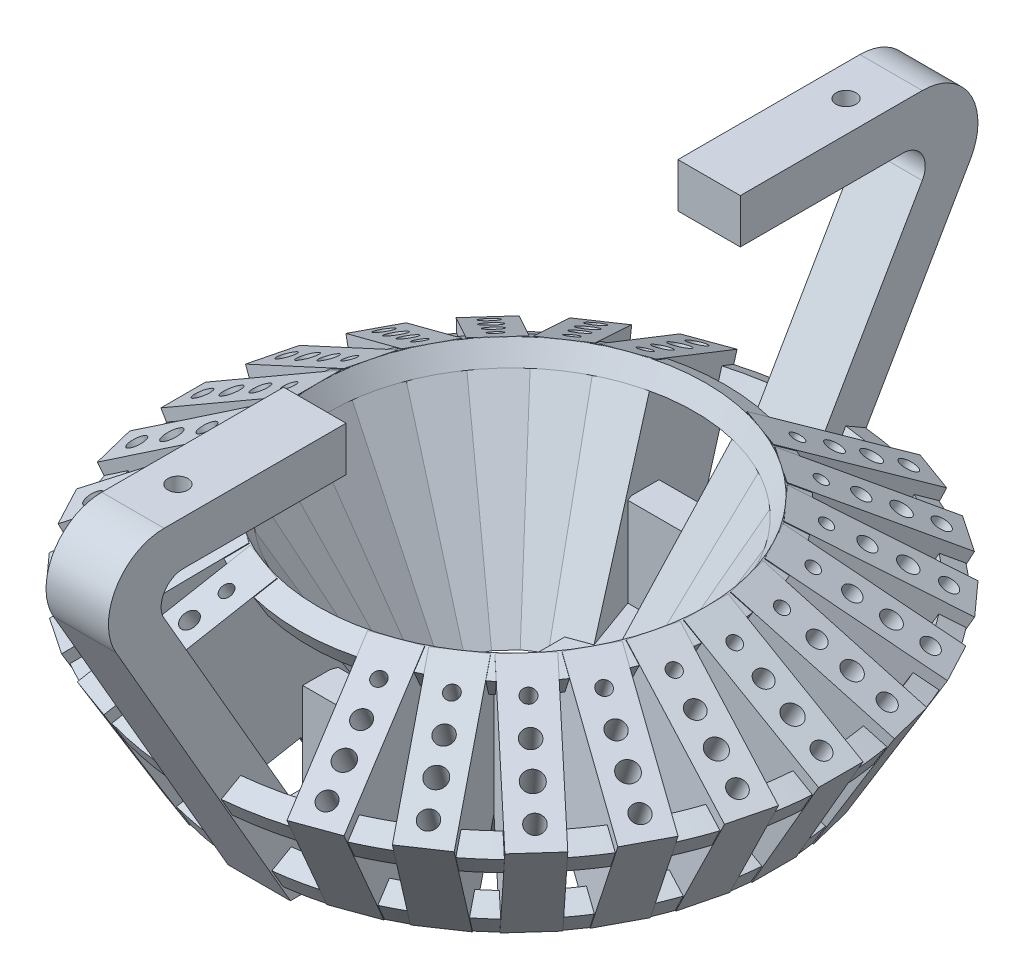
from build123d import *

# Parameters (mm, degrees)
KEYPIECE_DEPTH      = 1
REVOLVE4_ANGLE      = 90
REVOLVE5_ANGLE      = 90
CIRPATTERN12_COUNT  = 6
CIRPATTERN12_ANGLE  = 70
CIRPATTERN14_COUNT  = 6
CIRPATTERN14_ANGLE  = 70
SKKEYPIECEHOLES_8_R = 0.39
CUT_EXTRUDE8_DEPTH  = 5
SKKEYPIECEHOLES_R   = 0.3
SKKEYPIECEHOLES_R_2 = 0.43
CUT_EXTRUDE5_DEPTH  = 20.870506705
CIRPATTERN15_COUNT  = 6
CIRPATTERN15_ANGLE  = 70
CIRPATTERN16_COUNT  = 6
CIRPATTERN16_ANGLE  = 70
BOSS_EXTRUDE2_DEPTH = 1.4
SKETCH15_R          = 0.8
CUT_EXTRUDE6_DEPTH  = 10
SKETCH16_W          = 2.8
SKETCH16_H          = 1.5
BOSS_EXTRUDE4_DEPTH = 4
SKETCH17_R          = 0.45
CUT_EXTRUDE7_DEPTH  = 3.5


with BuildPart() as part:
    # skKeyPiece → KeyPiece (new, symmetric)
    with BuildSketch(Plane.XY):
        Polygon((8.700961894, 18.070508076), (14.763139721, 14.570508076), (11.763139721, 9.374355653), (7.866025404, 11.624355653), (5.866025404, 8.160254038), (5, 8.660254038), (3.700961894, 9.410254038), align=None)
    keypiece = extrude(amount=KEYPIECE_DEPTH, both=True)

    # Sketch11 → Revolve4 (revolve)
    with BuildSketch(Plane.XY):
        Polygon((14.523318583, 14.15512568), (13.657293179, 14.65512568), (13.157293179, 13.789100276), (14.023318583, 13.289100276), align=None)
        Polygon((6.366025404, 9.026279442), (5.5, 9.526279442), (5, 8.660254038), (5.866025404, 8.160254038), align=None)
        Polygon((11.763139721, 9.374355653), (12.263139721, 10.240381057), (11.397114317, 10.740381057), (10.897114317, 9.874355653), align=None)
        Polygon((8.700961894, 18.070508076), (8.200961894, 17.204482672), (9.066987298, 16.704482672), (9.566987298, 17.570508076), align=None)
    revolve(axis=Axis((0, 29.225564846, 0), (0, -1, 0)), revolution_arc=REVOLVE4_ANGLE)

    # Sketch11<2> → Revolve5 (revolve)
    with BuildSketch(Plane.XY):
        Polygon((14.523318583, 14.15512568), (13.657293179, 14.65512568), (13.157293179, 13.789100276), (14.023318583, 13.289100276), align=None)
        Polygon((6.366025404, 9.026279442), (5.5, 9.526279442), (5, 8.660254038), (5.866025404, 8.160254038), align=None)
        Polygon((11.763139721, 9.374355653), (12.263139721, 10.240381057), (11.397114317, 10.740381057), (10.897114317, 9.874355653), align=None)
        Polygon((8.700961894, 18.070508076), (8.200961894, 17.204482672), (9.066987298, 16.704482672), (9.566987298, 17.570508076), align=None)
    revolve(axis=Axis((0, 29.225564846, 0), (0, 1, 0)), revolution_arc=REVOLVE5_ANGLE)

    # CirPattern12: KeyPiece ×6 about axis
    cirpattern12_axis = Axis((0, 29.225564846, 0), (0, -1, 0))
    for i in range(1, CIRPATTERN12_COUNT):
        add(keypiece.rotate(cirpattern12_axis, i * CIRPATTERN12_ANGLE / (CIRPATTERN12_COUNT - 1)))

    # CirPattern14: KeyPiece ×6 about axis
    cirpattern14_axis = Axis((0, 29.225564846, 0), (0, 1, 0))
    for i in range(1, CIRPATTERN14_COUNT):
        add(keypiece.rotate(cirpattern14_axis, i * CIRPATTERN14_ANGLE / (CIRPATTERN14_COUNT - 1)))

    # skKeyPieceHoles<8> → Cut-Extrude8 (cut)
    with BuildSketch(Plane(origin=(10, 17.320508076, 0), x_dir=(0.8660254037844385, -0.5000000000000004, 0), z_dir=(0.5000000000000003, 0.8660254037844384, 0))):
        with Locations((1.5, 0)):
            Circle(SKKEYPIECEHOLES_8_R)
        with Locations((4.5, 0)):
            Circle(SKKEYPIECEHOLES_8_R)
    cut_extrude8 = extrude(amount=-CUT_EXTRUDE8_DEPTH, mode=Mode.SUBTRACT)

    # skKeyPieceHoles → Cut-Extrude5 (cut, through all)
    with BuildSketch(Plane(origin=(10, 17.320508076, 0), x_dir=(0.8660254037844385, -0.5000000000000004, 0), z_dir=(0.5000000000000003, 0.8660254037844384, 0))):
        Circle(SKKEYPIECEHOLES_R)
        with Locations((3, 0)):
            Circle(SKKEYPIECEHOLES_R_2)
    cut_extrude5 = extrude(amount=-CUT_EXTRUDE5_DEPTH, mode=Mode.SUBTRACT)

    # CirPattern15: Cut-Extrude8, Cut-Extrude5 ×6 about axis
    cirpattern15_axis = Axis((0, 29.225564846, 0), (0, -1, 0))
    add([cut_extrude8.rotate(cirpattern15_axis, i * CIRPATTERN15_ANGLE / (CIRPATTERN15_COUNT - 1)) for i in range(1, CIRPATTERN15_COUNT)], mode=Mode.SUBTRACT)
    add([cut_extrude5.rotate(cirpattern15_axis, i * CIRPATTERN15_ANGLE / (CIRPATTERN15_COUNT - 1)) for i in range(1, CIRPATTERN15_COUNT)], mode=Mode.SUBTRACT)

    # CirPattern16: Cut-Extrude8, Cut-Extrude5 ×6 about axis
    cirpattern16_axis = Axis((0, 29.225564846, 0), (0, 1, 0))
    add([cut_extrude8.rotate(cirpattern16_axis, i * CIRPATTERN16_ANGLE / (CIRPATTERN16_COUNT - 1)) for i in range(1, CIRPATTERN16_COUNT)], mode=Mode.SUBTRACT)
    add([cut_extrude5.rotate(cirpattern16_axis, i * CIRPATTERN16_ANGLE / (CIRPATTERN16_COUNT - 1)) for i in range(1, CIRPATTERN16_COUNT)], mode=Mode.SUBTRACT)

    # Mirror3: part across plane


with BuildPart() as part_1:
    add(part.part)
    add(part.part.mirror(Plane(origin=(0, 0, 0), x_dir=(0, 0, 1), z_dir=(1, 0, 0))))

    # Sketch13 → Boss-Extrude2 (add, symmetric)
    with BuildSketch(Plane(origin=(0, 0, 0), x_dir=(0, 0, -1), z_dir=(1, 0, 0))):
        with BuildLine():
            Line((11.350852961, 8.660254038), (19.185789452, 22.230762114))
            ThreePointArc((19.185789452, 22.230762114), (19.185789452, 24.730762114), (17.020725942, 25.980762114))
            Line((17.020725942, 25.980762114), (8.850852961, 25.980762114))
            Line((8.850852961, 25.980762114), (8.850852961, 23.980762114))
            Line((8.850852961, 23.980762114), (16.154700538, 23.980762114))
            ThreePointArc((16.154700538, 23.980762114), (17.020725942, 23.480762114), (17.020725942, 22.480762114))
            Line((17.020725942, 22.480762114), (9.791451884, 9.959292144))
            Line((9.791451884, 9.959292144), (-0.06009996, 9.959292144))
            Line((-0.06009996, 9.959292144), (-0.81009996, 8.660254038))
            Line((-0.81009996, 8.660254038), (11.350852961, 8.660254038))
        make_face()
    boss_extrude2 = extrude(amount=BOSS_EXTRUDE2_DEPTH, both=True)

    # Mirror4: Boss-Extrude2 across plane
    add(boss_extrude2.mirror(Plane.XY))

    # Sketch15 → Cut-Extrude6 (cut)
    with BuildSketch(Plane(origin=(0, 9.959292144, 0), x_dir=(1, 0, 0), z_dir=(0, 1, 0))):
        Circle(SKETCH15_R)
        with Locations((0, 2.25)):
            Circle(SKETCH15_R)
        with Locations((0, -2.25)):
            Circle(SKETCH15_R)
    extrude(amount=-CUT_EXTRUDE6_DEPTH, mode=Mode.SUBTRACT)

    # Sketch16 → Boss-Extrude4 (add)
    with BuildSketch(Plane(origin=(0, 9.959292144, 0), x_dir=(1, 0, 0), z_dir=(0, 1, 0))):
        with Locations((0, 7.25)):
            Rectangle(SKETCH16_W, SKETCH16_H)
        with Locations((0, -7.25)):
            Rectangle(SKETCH16_W, SKETCH16_H)
    extrude(amount=BOSS_EXTRUDE4_DEPTH)

    # Sketch17 → Cut-Extrude7 (cut)
    with BuildSketch(Plane(origin=(0, 25.980762114, 0), x_dir=(1, 0, 0), z_dir=(0, 1, 0))):
        with Locations((0, -15)):
            Circle(SKETCH17_R)
    cut_extrude7 = extrude(amount=-CUT_EXTRUDE7_DEPTH, mode=Mode.SUBTRACT)

    # Mirror5: Cut-Extrude7 across plane
    add(cut_extrude7.mirror(Plane.XY), mode=Mode.SUBTRACT)


solid = part_1.part
